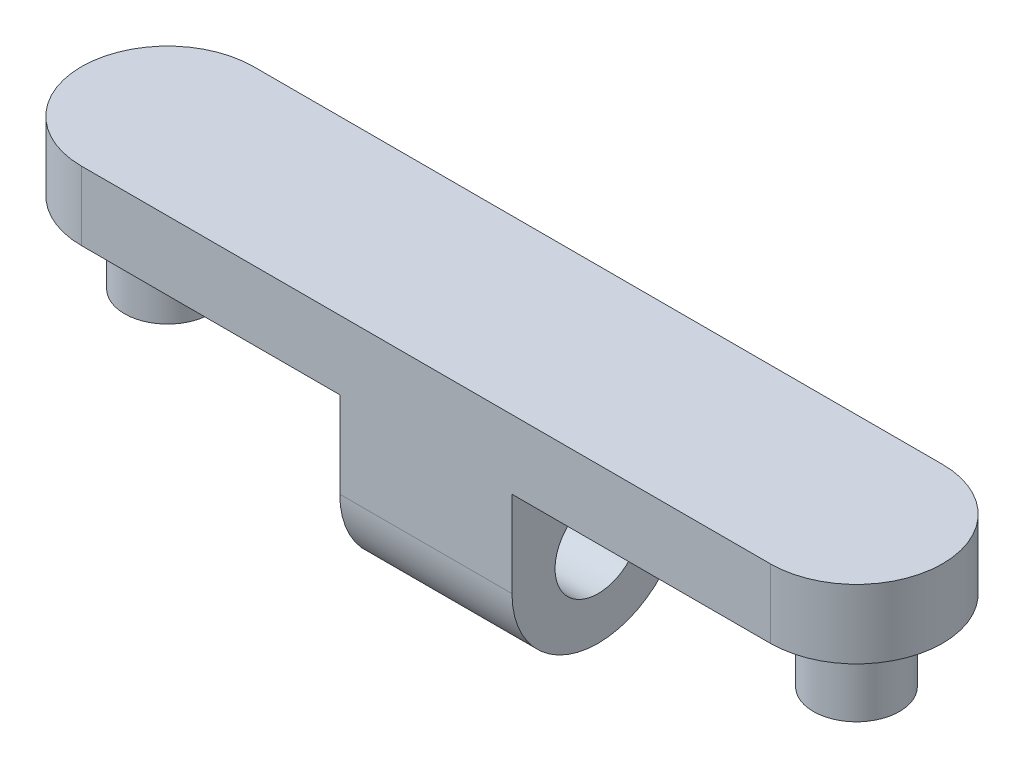
from build123d import *

# Parameters (mm, degrees)
BOSS_EXTRUDE1_DEPTH = 2.54
SKETCH1_4_R         = 1.5875
BOSS_EXTRUDE3_DEPTH = 2.9718
SKETCH4_W           = 6.35
SKETCH4_H           = 6.35
BOSS_EXTRUDE4_DEPTH = 6.35
SKETCH5_R           = 1.5875
CUT_EXTRUDE1_DEPTH  = 6.35
FILLET1_R           = 3.175


with BuildPart() as part:
    # Sketch1 → Boss-Extrude1 (new body)
    with BuildSketch(Plane(origin=(0, 0, 0), x_dir=(1, 0, 0), z_dir=(0, 1, 0))):
        with BuildLine():
            Line((-12.7, 3.175), (12.7, 3.175))
            ThreePointArc((12.7, 3.175), (15.875, 0), (12.7, -3.175))
            Line((12.7, -3.175), (-12.7, -3.175))
            ThreePointArc((-12.7, -3.175), (-15.875, 0), (-12.7, 3.175))
        make_face()
    extrude(amount=BOSS_EXTRUDE1_DEPTH)

    # Sketch1<4> → Boss-Extrude3 (add)
    with BuildSketch(Plane(origin=(0, 0, 0), x_dir=(1, 0, 0), z_dir=(0, 1, 0))):
        with Locations(Location((-12.7, 0, 0), (0, 0, 270))):
            Circle(SKETCH1_4_R)
        with Locations(Location((12.7, 0, 0), (0, 0, 270))):
            Circle(SKETCH1_4_R)
    extrude(amount=-BOSS_EXTRUDE3_DEPTH)

    # Sketch4 → Boss-Extrude4 (add)
    with BuildSketch(Plane.XZ):
        Rectangle(SKETCH4_W, SKETCH4_H)
    extrude(amount=BOSS_EXTRUDE4_DEPTH)

    # Sketch5 → Cut-Extrude1 (cut)
    with BuildSketch(Plane(origin=(3.175, 0, 0), x_dir=(0, 0, -1), z_dir=(1, 0, 0))):
        with Locations((0, -3.175)):
            Circle(SKETCH5_R)
    extrude(amount=-CUT_EXTRUDE1_DEPTH, mode=Mode.SUBTRACT)

    # Fillet1
    fillet1_edges = [part.edges().sort_by_distance(p)[0] for p in [
        (0, -6.35, 3.175),
        (0, -6.35, -3.175),
    ]]
    fillet(fillet1_edges, radius=FILLET1_R - 0.0001)  # a hair under: the kernel refuses the full size


solid = part.part
